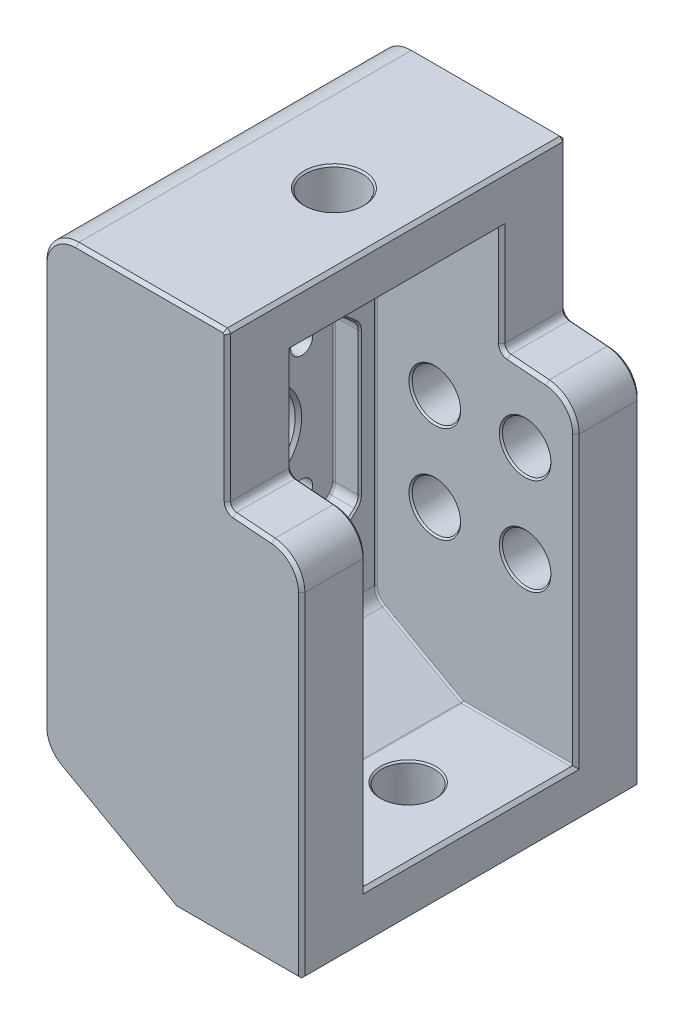
from build123d import *

# Parameters (mm, degrees)
DODANIE_WYCI_GNI_CIE1_DEPTH                         = 105
WYTNIJ_WYCI_GNI_CIE1_DEPTH                          = 65
SZKIC4_R                                            = 17.5
DODANIE_WYCI_GNI_CIE2_DEPTH                         = 19
WYTNIJ_WYCI_GNI_CIE2_REACH                          = 219.704
SZKIC5_R                                            = 14
POG_BIENIE_WALCOWE_POD_M8_WKR_T_Z_BEM_W_D           = 9
POG_BIENIE_WALCOWE_POD_M8_WKR_T_Z_BEM_W_DEPTH       = 47.5
POG_BIENIE_WALCOWE_POD_M8_WKR_T_Z_BEM_W_CBORE_D     = 15
POG_BIENIE_WALCOWE_POD_M8_WKR_T_Z_BEM_W_CBORE_DEPTH = 8.6
POG_BIENIE_WALCOWE_POD_M8_WKR_T_Z_BEM_W_TIP         = 2.703872786
ZAOKR_GLENIE3_R                                     = 10
SFAZOWANIE3_SIZE                                    = 1
SFAZOWANIE4_SIZE                                    = 1
SFAZOWANIE6_SIZE                                    = 1
ZAOKR_GLENIE4_R                                     = 3
SFAZOWANIE8_SIZE                                    = 1
ZAOKR_GLENIE5_R                                     = 0.5
SFAZOWANIE13_SIZE                                   = 0.5
SFAZOWANIE13_SIZE_2                                 = 0.477922207
SFAZOWANIE13_SIZE_3                                 = 0.525450382
SFAZOWANIE14_SIZE                                   = 0.5
SZKIC16_R                                           = 7.5
SZKIC16_R_2                                         = 4.5
WYTNIJ_WYCI_GNI_CIE8_DEPTH                          = 2.5
WYTNIJ_WYCI_GNI_CIE10_DEPTH                         = 8
ZAOKR_GLENIE8_R                                     = 4
OTW_R_GWINTOWANY_M81_D                              = 6.8
OTW_R_GWINTOWANY_M81_DEPTH                          = 22.25
OTW_R_GWINTOWANY_M81_TIP                            = 2.042926105
SFAZOWANIE15_SIZE                                   = 0.5
ZAOKR_GLENIE9_R                                     = 0.5
ZAOKR_GLENIE11_R                                    = 0.5
ZAOKR_GLENIE12_R                                    = 1
SFAZOWANIE16_SIZE                                   = 1


with BuildPart() as part:
    # Szkic2 → Dodanie-wyciągnięcie1 (new body)
    with BuildSketch(Plane.XY):
        with BuildLine():
            Line((-74.892509743, 20.134822539), (-39, 0))
            Line((-39, 0), (0, 0))
            Line((0, 0), (0, 104))
            ThreePointArc((0, 104), (-2.663485731, 110.795259994), (-9.235111677, 113.970704381))
            Line((-9.235111677, 113.970704381), (-21.152977665, 114.884966422))
            ThreePointArc((-21.152977665, 114.884966422), (-22.467302854, 115.520055299), (-23, 116.879107298))
            Line((-23, 116.879107298), (-23, 163))
            Line((-23, 163), (-80, 163))
            Line((-80, 163), (-80, 28.85625295))
            ThreePointArc((-80, 28.85625295), (-78.629168483, 23.802793611), (-74.892509743, 20.134822539))
        make_face()
    extrude(amount=DODANIE_WYCI_GNI_CIE1_DEPTH)

    # Szkic3 → Wytnij-wyciągnięcie1 (cut)
    with BuildSketch(Plane(origin=(0, 0, 20), x_dir=(-1, 0, 0), z_dir=(0, 0, -1))):
        with BuildLine():
            Line((62, 33.02957907), (62, 148))
            Line((62, 148), (23, 148))
            Line((23, 148), (23, 116.879107298))
            ThreePointArc((23, 116.879107298), (22.467302854, 115.520055299), (21.152977665, 114.884966422))
            Line((21.152977665, 114.884966422), (9.235111677, 113.970704381))
            ThreePointArc((9.235111677, 113.970704381), (2.663485731, 110.795259994), (0, 104))
            Line((0, 104), (0, 15))
            Line((0, 15), (35.080019286, 15))
            Line((35.080019286, 15), (59.446254871, 28.668863865))
            ThreePointArc((59.446254871, 28.668863865), (61.314584242, 30.502849401), (62, 33.02957907))
        make_face()
    extrude(amount=-WYTNIJ_WYCI_GNI_CIE1_DEPTH, mode=Mode.SUBTRACT)

    # Szkic4 → Dodanie-wyciągnięcie2 (add)
    with BuildSketch(Plane.ZY.offset(80)):
        with Locations(Location((50, 81.5, 0), (0, 0, 90))):
            Circle(SZKIC4_R)
    extrude(amount=DODANIE_WYCI_GNI_CIE2_DEPTH)

    # Szkic5 → Wytnij-wyciągnięcie2 (cut, up to next)
    with BuildSketch(Plane.ZY.offset(99), mode=Mode.PRIVATE) as wytnij_wyci_gni_cie2_sk1:
        with Locations(Location((50, 81.5, 0), (0, 0, 270))):
            Circle(SZKIC5_R)
    wytnij_wyci_gni_cie2_tool1 = extrude(wytnij_wyci_gni_cie2_sk1.sketch, amount=-WYTNIJ_WYCI_GNI_CIE2_REACH, mode=Mode.PRIVATE) & part.part
    add(wytnij_wyci_gni_cie2_tool1.solids().sort_by_distance((-99, 81.5, 50))[0], mode=Mode.SUBTRACT)

    # Pogłębienie walcowe pod M8 Wkręt z łbem walcowym z gniazdem sześciokątnym1
    with Locations(Plane.XY.offset(20)):
        with Locations((-43.741929592, 93), (-15.741929592, 93), (-43.741929592, 63), (-15.741929592, 63)):
            CounterBoreHole(POG_BIENIE_WALCOWE_POD_M8_WKR_T_Z_BEM_W_D / 2, POG_BIENIE_WALCOWE_POD_M8_WKR_T_Z_BEM_W_CBORE_D / 2, POG_BIENIE_WALCOWE_POD_M8_WKR_T_Z_BEM_W_CBORE_DEPTH, depth=POG_BIENIE_WALCOWE_POD_M8_WKR_T_Z_BEM_W_DEPTH)
            with Locations((0, 0, -(POG_BIENIE_WALCOWE_POD_M8_WKR_T_Z_BEM_W_DEPTH + POG_BIENIE_WALCOWE_POD_M8_WKR_T_Z_BEM_W_TIP / 2))):  # 118° drill point
                Cone(0, POG_BIENIE_WALCOWE_POD_M8_WKR_T_Z_BEM_W_D / 2, POG_BIENIE_WALCOWE_POD_M8_WKR_T_Z_BEM_W_TIP, mode=Mode.SUBTRACT)

    # Szkic13 → Wycięcie-obrót1 (revolve, cut)
    with BuildSketch(Plane(origin=(0, 0, 50), x_dir=(-1, 0, 0), z_dir=(0, 0, -1)), mode=Mode.PRIVATE) as wyci_cie_obr_t1_sk:
        Polygon((45, 167), (45, 148), (36.9, 148), (36, 167), align=None)
    revolve(wyci_cie_obr_t1_sk.sketch.rotate(Axis((-45, 167, 50), (0, -1, 0)), 90), axis=Axis((-45, 167, 50), (0, -1, 0)), mode=Mode.SUBTRACT)

    # Szkic14 → Wycięcie-obrót2 (revolve, cut)
    with BuildSketch(Plane(origin=(0, 0, 50), x_dir=(-1, 0, 0), z_dir=(0, 0, -1))):
        Polygon((22, -4), (22, 15), (13.9, 15), (13, -4), align=None)
    revolve(axis=Axis((-22, -4, 50), (0, 1, 0)), mode=Mode.SUBTRACT)

    # Zaokrąglenie3
    zaokr_glenie3_edges = [part.edges().sort_by_distance(p)[0] for p in [
        (-80, 163, 52.5),
    ]]
    fillet(zaokr_glenie3_edges, radius=ZAOKR_GLENIE3_R)

    # Sfazowanie3
    sfazowanie3_edges = [part.edges().sort_by_distance(p)[0] for p in [
        (-46.5, 163, 0),
        (-23, 139.939553649, 0),
        (-80, 90.928126475, 0),
        (-77.071067812, 160.071067812, 0),
        (-22.467302854, 115.520055299, 0),
        (-15.194044671, 114.427835401, 0),
        (-2.663485731, 110.795259994, 0),
        (0, 52, 0),
        (-19.5, 0, 0),
        (-56.946254871, 10.067411269, 0),
        (-78.629168483, 23.802793611, 0),
        (-23, 163, 52.5),
    ]]
    chamfer(sfazowanie3_edges, length=SFAZOWANIE3_SIZE)

    # Sfazowanie4
    sfazowanie4_edges = [part.edges().sort_by_distance(p)[0] for p in [
        (-80, 90.928126475, 105),
        (-77.071067812, 160.071067812, 105),
        (-19.5, 0, 105),
        (-47, 163, 105),
        (-23.5, 162.5, 105),
        (0, 52, 105),
        (-2.663485731, 110.795259994, 105),
        (-15.194044671, 114.427835401, 105),
        (-22.467302854, 115.520055299, 105),
        (-23, 139.439553649, 105),
        (-78.629168483, 23.802793611, 105),
        (-56.946254871, 10.067411269, 105),
    ]]
    chamfer(sfazowanie4_edges, length=SFAZOWANIE4_SIZE)

    # Sfazowanie6
    sfazowanie6_edges = [part.edges().sort_by_distance(p)[0] for p in [
        (0, 0, 52.5),
    ]]
    chamfer(sfazowanie6_edges, length=SFAZOWANIE6_SIZE)

    # Zaokrąglenie4
    zaokr_glenie4_edges = [part.edges().sort_by_distance(p)[0] for p in [
        (-39, 0, 52.5),
    ]]
    fillet(zaokr_glenie4_edges, radius=ZAOKR_GLENIE4_R)

    # Sfazowanie8
    sfazowanie8_edges = [part.edges().sort_by_distance(p)[0] for p in [
        (0, 59.5, 85),
        (0, 15, 52.5),
        (-2.663485731, 110.795259994, 85),
        (-15.194044671, 114.427835401, 85),
        (-22.467302854, 115.520055299, 85),
        (-23, 132.439553649, 85),
        (-23, 148, 52.5),
        (-23, 132.439553649, 20),
        (-22.467302854, 115.520055299, 20),
        (-15.194044671, 114.427835401, 20),
        (-2.663485731, 110.795259994, 20),
        (0, 59.5, 20),
    ]]
    chamfer(sfazowanie8_edges, length=SFAZOWANIE8_SIZE)

    # Zaokrąglenie5
    zaokr_glenie5_edges = [part.edges().sort_by_distance(p)[0] for p in [
        (-18.040009643, 15, 20),
        (-18.040009643, 15, 85),
        (-61.314584242, 30.502849401, 85),
        (-47.263137079, 21.834431932, 85),
        (-43, 148, 85),
        (-62, 90.514789535, 85),
        (-62, 148, 52.5),
        (-61.314584242, 30.502849401, 20),
        (-62, 90.514789535, 20),
        (-43, 148, 20),
        (-47.263137079, 21.834431932, 20),
    ]]
    fillet(zaokr_glenie5_edges, radius=ZAOKR_GLENIE5_R)

    # Sfazowanie13
    # the kernel refuses this chamfer: 0.525450382, 0.5, 0.477922207 mm, written as the material it takes off along each edge
    with BuildSketch(Plane(origin=(-45, 148, 50), x_dir=(0, 0, 1), z_dir=(1, 0, 0))) as sfazowanie13_piece_1:
        Polygon((8.1 + SFAZOWANIE13_SIZE, 0), (8.1 + SFAZOWANIE13_SIZE_2 * 0.0473153684751, -SFAZOWANIE13_SIZE_2 * 0.998880001141), (8.1, 0), align=None)
    revolve(axis=Axis((-45, 148, 50), (0, -1, 0)), mode=Mode.SUBTRACT)
    with BuildSketch(Plane(origin=(-45, 163, 50), x_dir=(0, 0, 1), z_dir=(-1, 0, 0))) as sfazowanie13_piece_2:
        Polygon((8.810526316 - SFAZOWANIE13_SIZE_3 * 0.0473153685005, -SFAZOWANIE13_SIZE_3 * 0.998880001676), (8.810526316 + SFAZOWANIE13_SIZE, 0), (8.810526316, 0), align=None)
    revolve(axis=Axis((-45, 163, 50), (0, 1, 0)), mode=Mode.SUBTRACT)
    with BuildSketch(Plane(origin=(-22, 15, 50), x_dir=(1, 0, 0), z_dir=(0, 0, 1))) as sfazowanie13_piece_3:
        Polygon((8.1 + SFAZOWANIE13_SIZE, 0), (8.1 + SFAZOWANIE13_SIZE_2 * 0.0473153684751, -SFAZOWANIE13_SIZE_2 * 0.998880001141), (8.1, 0), align=None)
    revolve(axis=Axis((-22, 15, 50), (0, 1, 0)), mode=Mode.SUBTRACT)
    with BuildSketch(Plane(origin=(-22, 0, 50), x_dir=(1, 0, 0), z_dir=(0, 0, -1))) as sfazowanie13_piece_4:
        Polygon((8.810526316 - SFAZOWANIE13_SIZE * 0.0473153684568, -SFAZOWANIE13_SIZE * 0.998880000755), (8.810526316 + SFAZOWANIE13_SIZE_3, 0), (8.810526316, 0), align=None)
    revolve(axis=Axis((-22, 0, 50), (0, -1, 0)), mode=Mode.SUBTRACT)

    # Sfazowanie14
    sfazowanie14_edges = [part.edges().sort_by_distance(p)[0] for p in [
        (-11.241929592, 63, 0),
        (-23.241929592, 63, 20),
        (-39.241929592, 63, 0),
        (-51.241929592, 63, 20),
        (-11.241929592, 93, 0),
        (-23.241929592, 93, 20),
        (-39.241929592, 93, 0),
        (-51.241929592, 93, 20),
    ]]
    chamfer(sfazowanie14_edges, length=SFAZOWANIE14_SIZE)

    # Szkic16 → Wytnij-wyciągnięcie8 (cut)
    # profile 1 of 4: a face of its own
    with BuildSketch(Plane.XY.offset(11.4)):
        with Locations((-43.741929592, 93)):
            Circle(SZKIC16_R)
        with Locations((-43.741929592, 93)):
            Circle(SZKIC16_R_2, mode=Mode.SUBTRACT)
    # profile 2 of 4: a face of its own
    with BuildSketch(Plane.XY.offset(11.4)):
        with Locations((-15.741929592, 63)):
            Circle(SZKIC16_R)
        with Locations((-15.741929592, 63)):
            Circle(SZKIC16_R_2, mode=Mode.SUBTRACT)
    # profile 3 of 4: a face of its own
    with BuildSketch(Plane.XY.offset(11.4)):
        with Locations((-15.741929592, 93)):
            Circle(SZKIC16_R)
        with Locations((-15.741929592, 93)):
            Circle(SZKIC16_R_2, mode=Mode.SUBTRACT)
    # profile 4 of 4: a face of its own
    with BuildSketch(Plane.XY.offset(11.4)):
        with Locations((-43.741929592, 63)):
            Circle(SZKIC16_R)
        with Locations((-43.741929592, 63)):
            Circle(SZKIC16_R_2, mode=Mode.SUBTRACT)
    extrude(amount=-WYTNIJ_WYCI_GNI_CIE8_DEPTH, mode=Mode.SUBTRACT)

    # Szkic17 → Wytnij-wyciągnięcie10 (cut)
    with BuildSketch(Plane(origin=(-62, 0, 0), x_dir=(0, 0, -1), z_dir=(1, 0, 0))):
        with BuildLine():
            Line((-75, 105.274986856), (-75, 57.725013144))
            ThreePointArc((-75, 57.725013144), (-50, 47), (-25, 57.725013144))
            Line((-25, 57.725013144), (-25, 105.274986856))
            ThreePointArc((-25, 105.274986856), (-50, 116), (-75, 105.274986856))
        make_face()
    extrude(amount=-WYTNIJ_WYCI_GNI_CIE10_DEPTH, mode=Mode.SUBTRACT)

    # Zaokrąglenie8
    zaokr_glenie8_edges = [part.edges().sort_by_distance(p)[0] for p in [
        (-66, 105.274986856, 75),
        (-66, 105.274986856, 25),
        (-66, 57.725013144, 25),
        (-66, 57.725013144, 75),
    ]]
    fillet(zaokr_glenie8_edges, radius=ZAOKR_GLENIE8_R)

    # Otwór gwintowany M81
    with Locations(Plane(origin=(-70, 0, 0), x_dir=(0, 0, -1), z_dir=(1, 0, 0))):
        with Locations((-65, 101.5), (-50, 107.5), (-35, 101.5), (-65, 61.5), (-50, 55.5), (-35, 61.5)):
            Hole(OTW_R_GWINTOWANY_M81_D / 2, depth=OTW_R_GWINTOWANY_M81_DEPTH)
            with Locations((0, 0, -(OTW_R_GWINTOWANY_M81_DEPTH + OTW_R_GWINTOWANY_M81_TIP / 2))):  # 118° drill point
                Cone(0, OTW_R_GWINTOWANY_M81_D / 2, OTW_R_GWINTOWANY_M81_TIP, mode=Mode.SUBTRACT)

    # Sfazowanie15
    sfazowanie15_edges = [part.edges().sort_by_distance(p)[0] for p in [
        (-62, 47, 50),
        (-62, 81.5, 75),
        (-62, 81.5, 25),
        (-62, 116, 50),
        (-62, 57.802458968, 74.675349877),
        (-62, 57.802458968, 25.324650123),
        (-62, 105.197541032, 25.324650123),
        (-62, 105.197541032, 74.675349877),
    ]]
    chamfer(sfazowanie15_edges, length=SFAZOWANIE15_SIZE)

    # Zaokrąglenie9
    zaokr_glenie9_edges = [part.edges().sort_by_distance(p)[0] for p in [
        (-70, 47, 50),
        (-70, 81.5, 75),
        (-70, 116, 50),
        (-70, 81.5, 25),
        (-70, 105.197541032, 74.675349877),
        (-70, 105.197541032, 25.324650123),
        (-70, 57.802458968, 25.324650123),
        (-70, 57.802458968, 74.675349877),
    ]]
    fillet(zaokr_glenie9_edges, radius=ZAOKR_GLENIE9_R)

    # Zaokrąglenie11
    zaokr_glenie11_edges = [part.edges().sort_by_distance(p)[0] for p in [
        (-35.080019286, 15, 52.5),
        (-35.040982277, 15.149377045, 20.143540264),
        (-35.040982277, 15.149377045, 84.856459736),
    ]]
    fillet(zaokr_glenie11_edges, radius=ZAOKR_GLENIE11_R)

    # Zaokrąglenie12
    zaokr_glenie12_edges = [part.edges().sort_by_distance(p)[0] for p in [
        (-80, 64, 50),
    ]]
    fillet(zaokr_glenie12_edges, radius=ZAOKR_GLENIE12_R)

    # Sfazowanie16
    sfazowanie16_edges = [part.edges().sort_by_distance(p)[0] for p in [
        (-70, 95.5, 50),
        (-99, 64, 50),
        (-99, 95.5, 50),
    ]]
    chamfer(sfazowanie16_edges, length=SFAZOWANIE16_SIZE)


solid = part.part
